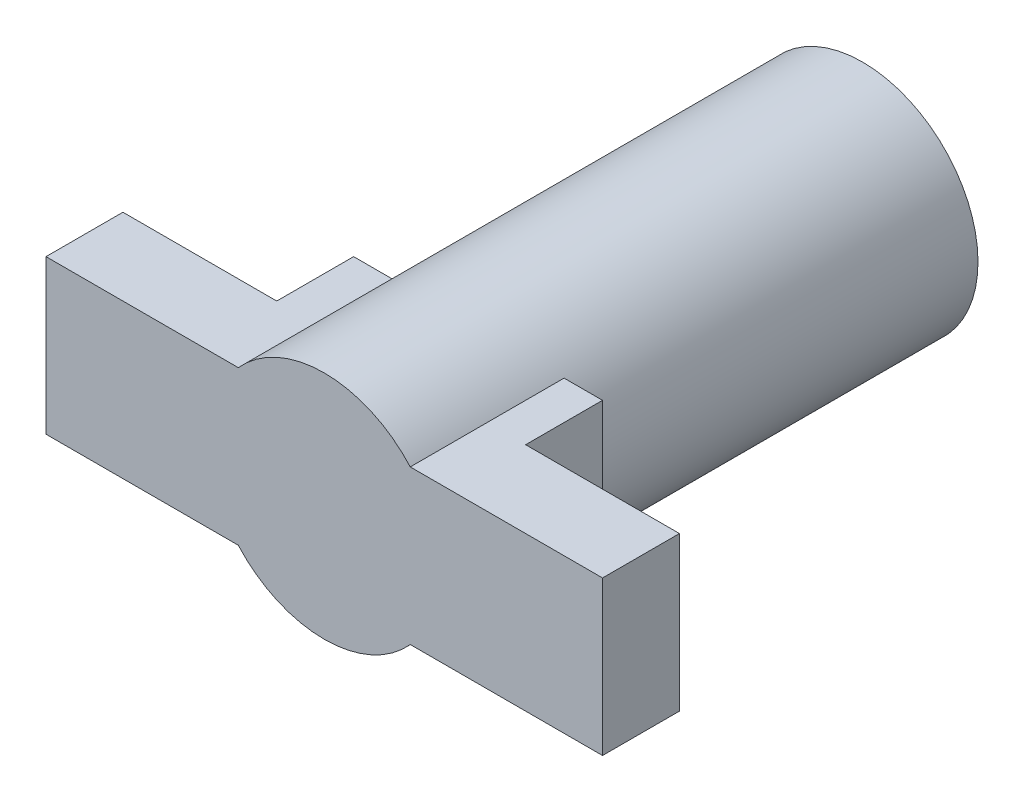
from build123d import *

# Parameters (mm, degrees)
CROQUIS1_R              = 15
SALIENTE_EXTRUIR1_DEPTH = 35
CROQUIS10_W             = 25
CROQUIS10_H             = 20
SALIENTE_EXTRUIR8_DEPTH = 20
CROQUIS11_W             = 20
CROQUIS11_H             = 20
CORTAR_EXTRUIR1_DEPTH   = 10


with BuildPart() as part:
    # Croquis1 → Saliente-Extruir1 (new, symmetric)
    with BuildSketch(Plane.XY):
        Circle(CROQUIS1_R)
    extrude(amount=SALIENTE_EXTRUIR1_DEPTH, both=True)

    # Croquis10 → Saliente-Extruir8 (add)
    with BuildSketch(Plane.XY.offset(35)):
        with Locations((-23.680339887, 0)):
            Rectangle(CROQUIS10_W, CROQUIS10_H)
        with Locations((23.680339887, 0)):
            Rectangle(CROQUIS10_W, CROQUIS10_H)
    extrude(amount=-SALIENTE_EXTRUIR8_DEPTH)

    # Croquis11 → Cortar-Extruir1 (cut)
    with BuildSketch(Plane.XY.offset(15)):
        with Locations((-26.180339887, 0)):
            Rectangle(CROQUIS11_W, CROQUIS11_H)
        with Locations((26.180339887, 0)):
            Rectangle(CROQUIS11_W, CROQUIS11_H)
    extrude(amount=CORTAR_EXTRUIR1_DEPTH, mode=Mode.SUBTRACT)


solid = part.part
